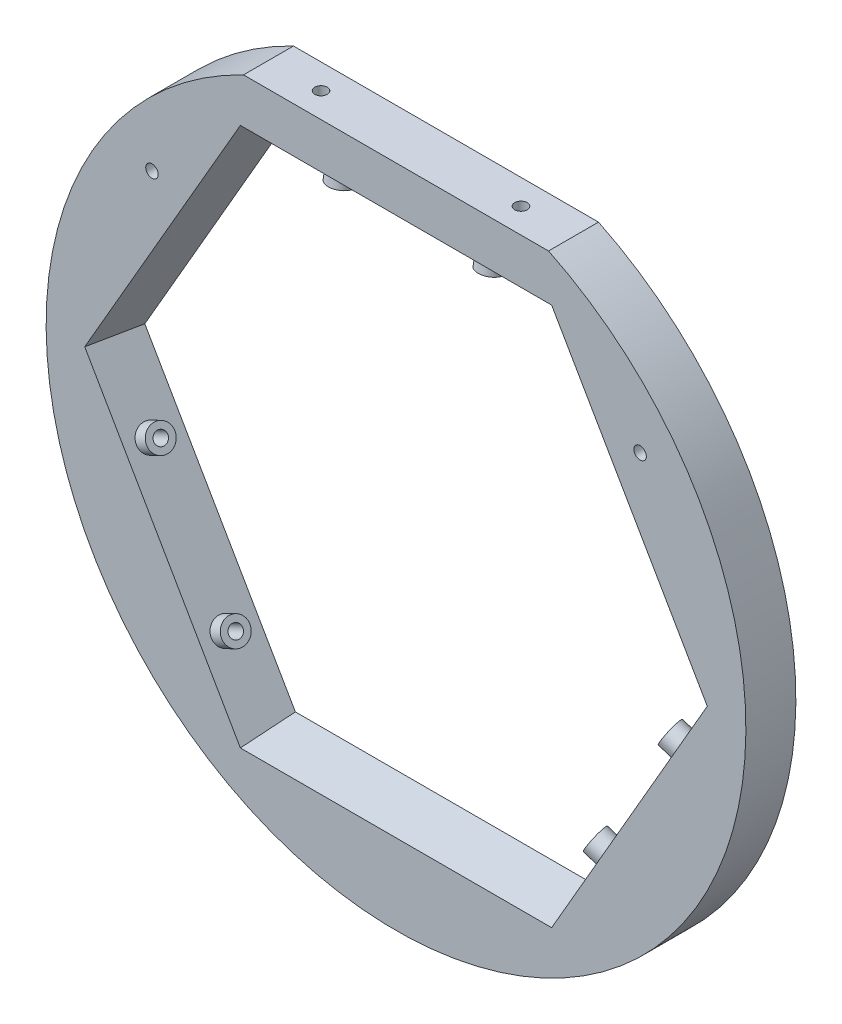
from build123d import *

# Parameters (mm, degrees)
ESQUISSE1_R                  = 70
BOSS_EXTRU_1_DEPTH           = 10
CHANFREIN1_SIZE              = 10.000000024
CHANFREIN1_SIZE_2            = 1.74707794
ESQUISSE2_R                  = 1.25
ENL_V_MAT_EXTRU_1_DEPTH      = 8
BOSS_EXTRU_2_START           = 3
ESQUISSE3_R                  = 2.5
ESQUISSE3_R_2                = 1.25
BOSS_EXTRU_2_DEPTH           = 3
R_P_TITION_CIRCULAIRE1_COUNT = 3
ENL_V_MAT_EXTRU_2_REACH      = 101.499
ESQUISSE5_R                  = 1.25
ENL_V_MAT_EXTRU_3_DEPTH      = 8
ENL_V_MAT_EXTRU_4_REACH      = 101.499
ESQUISSE6_R                  = 1.25


with BuildPart() as part:
    # Esquisse1 → Boss.-Extru.1 (new body)
    with BuildSketch(Plane.XY):
        Circle(ESQUISSE1_R)
        Polygon((60.258047595, 0), (30.129023798, 52.185), (-30.129023798, 52.185), (-60.258047595, 0), (-30.129023798, -52.185), (30.129023798, -52.185), align=None, mode=Mode.SUBTRACT)
    extrude(amount=BOSS_EXTRU_1_DEPTH)

    # Chanfrein1
    # the kernel refuses this chamfer: 10.000000024, 1.74707794 mm, written as the material it takes off along each edge
    with BuildSketch(Plane(origin=(-17.136199158, 74.68923241, 10), x_dir=(0.005735622158407684, -0.0033114629971266528, -0.9999780681851351), z_dir=(-0.49999999999999933, -0.866025403784439, 0))) as chanfrein1_piece_1_section:
        Polygon((CHANFREIN1_SIZE * 0.999978068229, -CHANFREIN1_SIZE * 0.00662292599454), (-CHANFREIN1_SIZE_2 * 0.00662292599425, -CHANFREIN1_SIZE_2 * 0.999978068185), (0, 0), align=None)
    chanfrein1_piece_1 = extrude(amount=112.229346155, mode=Mode.PRIVATE)
    chanfrein1_piece_1 = split(chanfrein1_piece_1, bisect_by=Plane(origin=(-67.992097392, 13.395767196, 6.396743043), z_dir=(0.8660254037844387, 0.5000000000000003, 0)), keep=Keep.TOP, mode=Mode.PRIVATE)
    chanfrein1_piece_1 = split(chanfrein1_piece_1, bisect_by=Plane(origin=(-45.597123391, 52.185, 6.396743043), z_dir=(0, -1, 0)), keep=Keep.TOP, mode=Mode.PRIVATE)
    add(chanfrein1_piece_1, mode=Mode.SUBTRACT)
    with BuildSketch(Plane(origin=(-73.250872235, 22.50423241, 10), x_dir=(0.005735622158407019, 0.0033114629971262776, -0.9999780681851351), z_dir=(0.5000000000000003, -0.8660254037844386, 0))) as chanfrein1_piece_2_section:
        Polygon((CHANFREIN1_SIZE * 0.999978068229, -CHANFREIN1_SIZE * 0.00662292599454), (-CHANFREIN1_SIZE_2 * 0.00662292599425, -CHANFREIN1_SIZE_2 * 0.999978068185), (0, 0), align=None)
    chanfrein1_piece_2 = extrude(amount=112.229346155, mode=Mode.PRIVATE)
    chanfrein1_piece_2 = split(chanfrein1_piece_2, bisect_by=Plane(origin=(-45.597123391, -52.185, 6.396743043), z_dir=(0, 1, 0)), keep=Keep.TOP, mode=Mode.PRIVATE)
    chanfrein1_piece_2 = split(chanfrein1_piece_2, bisect_by=Plane(origin=(-67.992097392, -13.395767196, 6.396743043), z_dir=(0.866025403784439, -0.49999999999999933, 0)), keep=Keep.TOP, mode=Mode.PRIVATE)
    add(chanfrein1_piece_2, mode=Mode.SUBTRACT)
    with BuildSketch(Plane(origin=(-56.114673077, -52.185, 10), x_dir=(0, 0.006622925994253088, -0.9999780681851351), z_dir=(1, 0, 0))) as chanfrein1_piece_3_section:
        Polygon((CHANFREIN1_SIZE * 0.999978068229, -CHANFREIN1_SIZE * 0.00662292599454), (-CHANFREIN1_SIZE_2 * 0.00662292599425, -CHANFREIN1_SIZE_2 * 0.999978068185), (0, 0), align=None)
    chanfrein1_piece_3 = extrude(amount=112.229346155, mode=Mode.PRIVATE)
    chanfrein1_piece_3 = split(chanfrein1_piece_3, bisect_by=Plane(origin=(22.394974001, -65.580767196, 6.396743043), z_dir=(-0.8660254037844392, 0.4999999999999993, 0)), keep=Keep.TOP, mode=Mode.PRIVATE)
    chanfrein1_piece_3 = split(chanfrein1_piece_3, bisect_by=Plane(origin=(-22.394974001, -65.580767196, 6.396743043), z_dir=(0.8660254037844387, 0.5000000000000003, 0)), keep=Keep.TOP, mode=Mode.PRIVATE)
    add(chanfrein1_piece_3, mode=Mode.SUBTRACT)
    with BuildSketch(Plane(origin=(17.136199158, -74.68923241, 10), x_dir=(-0.005735622158407349, 0.0033114629971264585, -0.9999780681851351), z_dir=(0.4999999999999993, 0.8660254037844392, 0))) as chanfrein1_piece_4_section:
        Polygon((CHANFREIN1_SIZE * 0.999978068229, -CHANFREIN1_SIZE * 0.00662292599454), (-CHANFREIN1_SIZE_2 * 0.00662292599425, -CHANFREIN1_SIZE_2 * 0.999978068185), (0, 0), align=None)
    chanfrein1_piece_4 = extrude(amount=112.229346155, mode=Mode.PRIVATE)
    chanfrein1_piece_4 = split(chanfrein1_piece_4, bisect_by=Plane(origin=(45.597123391, -52.185, 6.396743043), z_dir=(0, 1, 0)), keep=Keep.TOP, mode=Mode.PRIVATE)
    chanfrein1_piece_4 = split(chanfrein1_piece_4, bisect_by=Plane(origin=(67.992097392, -13.395767196, 6.396743043), z_dir=(-0.8660254037844386, -0.5000000000000001, 0)), keep=Keep.TOP, mode=Mode.PRIVATE)
    add(chanfrein1_piece_4, mode=Mode.SUBTRACT)
    with BuildSketch(Plane(origin=(73.250872235, -22.50423241, 10), x_dir=(-0.005735622158407169, -0.0033114629971263618, -0.9999780681851351), z_dir=(-0.5000000000000001, 0.8660254037844386, 0))) as chanfrein1_piece_5_section:
        Polygon((CHANFREIN1_SIZE * 0.999978068229, -CHANFREIN1_SIZE * 0.00662292599454), (-CHANFREIN1_SIZE_2 * 0.00662292599425, -CHANFREIN1_SIZE_2 * 0.999978068185), (0, 0), align=None)
    chanfrein1_piece_5 = extrude(amount=112.229346155, mode=Mode.PRIVATE)
    chanfrein1_piece_5 = split(chanfrein1_piece_5, bisect_by=Plane(origin=(67.992097392, 13.395767196, 6.396743043), z_dir=(-0.8660254037844392, 0.4999999999999993, 0)), keep=Keep.TOP, mode=Mode.PRIVATE)
    chanfrein1_piece_5 = split(chanfrein1_piece_5, bisect_by=Plane(origin=(45.597123391, 52.185, 6.396743043), z_dir=(0, -1, 0)), keep=Keep.TOP, mode=Mode.PRIVATE)
    add(chanfrein1_piece_5, mode=Mode.SUBTRACT)
    with BuildSketch(Plane(origin=(56.114673077, 52.185, 10), x_dir=(0, -0.006622925994253088, -0.9999780681851351), z_dir=(-1, 0, 0))) as chanfrein1_piece_6_section:
        Polygon((CHANFREIN1_SIZE * 0.999978068229, -CHANFREIN1_SIZE * 0.00662292599454), (-CHANFREIN1_SIZE_2 * 0.00662292599425, -CHANFREIN1_SIZE_2 * 0.999978068185), (0, 0), align=None)
    chanfrein1_piece_6 = extrude(amount=112.229346155, mode=Mode.PRIVATE)
    chanfrein1_piece_6 = split(chanfrein1_piece_6, bisect_by=Plane(origin=(-22.394974001, 65.580767196, 6.396743043), z_dir=(0.866025403784439, -0.49999999999999933, 0)), keep=Keep.TOP, mode=Mode.PRIVATE)
    chanfrein1_piece_6 = split(chanfrein1_piece_6, bisect_by=Plane(origin=(22.394974001, 65.580767196, 6.396743043), z_dir=(-0.8660254037844386, -0.5000000000000001, 0)), keep=Keep.TOP, mode=Mode.PRIVATE)
    add(chanfrein1_piece_6, mode=Mode.SUBTRACT)
    with BuildSketch(Plane(origin=(-17.136199158, 74.68923241, 10), x_dir=(0.005735622158407684, -0.0033114629971266528, -0.9999780681851351), z_dir=(-0.49999999999999933, -0.866025403784439, 0))) as chanfrein1_piece_7a_section:
        Polygon((CHANFREIN1_SIZE * 0.999978068229, -CHANFREIN1_SIZE * 0.00662292599454), (-CHANFREIN1_SIZE_2 * 0.00662292599425, -CHANFREIN1_SIZE_2 * 0.999978068185), (0, 0), align=None)
    chanfrein1_piece_7a = extrude(amount=112.229346155, mode=Mode.PRIVATE)
    chanfrein1_piece_7a = split(chanfrein1_piece_7a, bisect_by=Plane(origin=(-24.113171626, 52.185, 6.425736603), z_dir=(0, 1, 0)), keep=Keep.TOP, mode=Mode.PRIVATE)
    with BuildSketch(Plane(origin=(56.114673077, 52.185, 10), x_dir=(0, -0.006622925994253088, -0.9999780681851351), z_dir=(-1, 0, 0))) as chanfrein1_piece_7b_section:
        Polygon((CHANFREIN1_SIZE * 0.999978068229, -CHANFREIN1_SIZE * 0.00662292599454), (-CHANFREIN1_SIZE_2 * 0.00662292599425, -CHANFREIN1_SIZE_2 * 0.999978068185), (0, 0), align=None)
    chanfrein1_piece_7b = extrude(amount=112.229346155, mode=Mode.PRIVATE)
    chanfrein1_piece_7b = split(chanfrein1_piece_7b, bisect_by=Plane(origin=(-33.136949884, 46.975119194, 6.425736603), z_dir=(-0.866025403784439, 0.49999999999999933, 0)), keep=Keep.TOP, mode=Mode.PRIVATE)
    chanfrein1_piece_7 = chanfrein1_piece_7a & chanfrein1_piece_7b
    add(chanfrein1_piece_7, mode=Mode.SUBTRACT)
    with BuildSketch(Plane(origin=(-73.250872235, 22.50423241, 10), x_dir=(0.005735622158407019, 0.0033114629971262776, -0.9999780681851351), z_dir=(0.5000000000000003, -0.8660254037844386, 0))) as chanfrein1_piece_8a_section:
        Polygon((CHANFREIN1_SIZE * 0.999978068229, -CHANFREIN1_SIZE * 0.00662292599454), (-CHANFREIN1_SIZE_2 * 0.00662292599425, -CHANFREIN1_SIZE_2 * 0.999978068185), (0, 0), align=None)
    chanfrein1_piece_8a = extrude(amount=112.229346155, mode=Mode.PRIVATE)
    chanfrein1_piece_8a = split(chanfrein1_piece_8a, bisect_by=Plane(origin=(-57.250121509, 5.209880806, 6.425736603), z_dir=(-0.866025403784439, 0.49999999999999933, 0)), keep=Keep.TOP, mode=Mode.PRIVATE)
    with BuildSketch(Plane(origin=(-17.136199158, 74.68923241, 10), x_dir=(0.005735622158407684, -0.0033114629971266528, -0.9999780681851351), z_dir=(-0.49999999999999933, -0.866025403784439, 0))) as chanfrein1_piece_8b_section:
        Polygon((CHANFREIN1_SIZE * 0.999978068229, -CHANFREIN1_SIZE * 0.00662292599454), (-CHANFREIN1_SIZE_2 * 0.00662292599425, -CHANFREIN1_SIZE_2 * 0.999978068185), (0, 0), align=None)
    chanfrein1_piece_8b = extrude(amount=112.229346155, mode=Mode.PRIVATE)
    chanfrein1_piece_8b = split(chanfrein1_piece_8b, bisect_by=Plane(origin=(-57.250121509, -5.209880806, 6.425736603), z_dir=(-0.8660254037844387, -0.5000000000000003, 0)), keep=Keep.TOP, mode=Mode.PRIVATE)
    chanfrein1_piece_8 = chanfrein1_piece_8a & chanfrein1_piece_8b
    add(chanfrein1_piece_8, mode=Mode.SUBTRACT)
    with BuildSketch(Plane(origin=(-56.114673077, -52.185, 10), x_dir=(0, 0.006622925994253088, -0.9999780681851351), z_dir=(1, 0, 0))) as chanfrein1_piece_9a_section:
        Polygon((CHANFREIN1_SIZE * 0.999978068229, -CHANFREIN1_SIZE * 0.00662292599454), (-CHANFREIN1_SIZE_2 * 0.00662292599425, -CHANFREIN1_SIZE_2 * 0.999978068185), (0, 0), align=None)
    chanfrein1_piece_9a = extrude(amount=112.229346155, mode=Mode.PRIVATE)
    chanfrein1_piece_9a = split(chanfrein1_piece_9a, bisect_by=Plane(origin=(-33.136949884, -46.975119194, 6.425736603), z_dir=(-0.8660254037844387, -0.5000000000000003, 0)), keep=Keep.TOP, mode=Mode.PRIVATE)
    with BuildSketch(Plane(origin=(-73.250872235, 22.50423241, 10), x_dir=(0.005735622158407019, 0.0033114629971262776, -0.9999780681851351), z_dir=(0.5000000000000003, -0.8660254037844386, 0))) as chanfrein1_piece_9b_section:
        Polygon((CHANFREIN1_SIZE * 0.999978068229, -CHANFREIN1_SIZE * 0.00662292599454), (-CHANFREIN1_SIZE_2 * 0.00662292599425, -CHANFREIN1_SIZE_2 * 0.999978068185), (0, 0), align=None)
    chanfrein1_piece_9b = extrude(amount=112.229346155, mode=Mode.PRIVATE)
    chanfrein1_piece_9b = split(chanfrein1_piece_9b, bisect_by=Plane(origin=(-24.113171626, -52.185, 6.425736603), z_dir=(0, -1, 0)), keep=Keep.TOP, mode=Mode.PRIVATE)
    chanfrein1_piece_9 = chanfrein1_piece_9a & chanfrein1_piece_9b
    add(chanfrein1_piece_9, mode=Mode.SUBTRACT)
    with BuildSketch(Plane(origin=(17.136199158, -74.68923241, 10), x_dir=(-0.005735622158407349, 0.0033114629971264585, -0.9999780681851351), z_dir=(0.4999999999999993, 0.8660254037844392, 0))) as chanfrein1_piece_10a_section:
        Polygon((CHANFREIN1_SIZE * 0.999978068229, -CHANFREIN1_SIZE * 0.00662292599454), (-CHANFREIN1_SIZE_2 * 0.00662292599425, -CHANFREIN1_SIZE_2 * 0.999978068185), (0, 0), align=None)
    chanfrein1_piece_10a = extrude(amount=112.229346155, mode=Mode.PRIVATE)
    chanfrein1_piece_10a = split(chanfrein1_piece_10a, bisect_by=Plane(origin=(24.113171626, -52.185, 6.425736603), z_dir=(0, -1, 0)), keep=Keep.TOP, mode=Mode.PRIVATE)
    with BuildSketch(Plane(origin=(-56.114673077, -52.185, 10), x_dir=(0, 0.006622925994253088, -0.9999780681851351), z_dir=(1, 0, 0))) as chanfrein1_piece_10b_section:
        Polygon((CHANFREIN1_SIZE * 0.999978068229, -CHANFREIN1_SIZE * 0.00662292599454), (-CHANFREIN1_SIZE_2 * 0.00662292599425, -CHANFREIN1_SIZE_2 * 0.999978068185), (0, 0), align=None)
    chanfrein1_piece_10b = extrude(amount=112.229346155, mode=Mode.PRIVATE)
    chanfrein1_piece_10b = split(chanfrein1_piece_10b, bisect_by=Plane(origin=(33.136949884, -46.975119194, 6.425736603), z_dir=(0.8660254037844392, -0.4999999999999993, 0)), keep=Keep.TOP, mode=Mode.PRIVATE)
    chanfrein1_piece_10 = chanfrein1_piece_10a & chanfrein1_piece_10b
    add(chanfrein1_piece_10, mode=Mode.SUBTRACT)
    with BuildSketch(Plane(origin=(17.136199158, -74.68923241, 10), x_dir=(-0.005735622158407349, 0.0033114629971264585, -0.9999780681851351), z_dir=(0.4999999999999993, 0.8660254037844392, 0))) as chanfrein1_piece_11a_section:
        Polygon((CHANFREIN1_SIZE * 0.999978068229, -CHANFREIN1_SIZE * 0.00662292599454), (-CHANFREIN1_SIZE_2 * 0.00662292599425, -CHANFREIN1_SIZE_2 * 0.999978068185), (0, 0), align=None)
    chanfrein1_piece_11a = extrude(amount=112.229346155, mode=Mode.PRIVATE)
    chanfrein1_piece_11a = split(chanfrein1_piece_11a, bisect_by=Plane(origin=(57.250121509, 5.209880806, 6.425736603), z_dir=(0.8660254037844386, 0.5000000000000001, 0)), keep=Keep.TOP, mode=Mode.PRIVATE)
    with BuildSketch(Plane(origin=(73.250872235, -22.50423241, 10), x_dir=(-0.005735622158407169, -0.0033114629971263618, -0.9999780681851351), z_dir=(-0.5000000000000001, 0.8660254037844386, 0))) as chanfrein1_piece_11b_section:
        Polygon((CHANFREIN1_SIZE * 0.999978068229, -CHANFREIN1_SIZE * 0.00662292599454), (-CHANFREIN1_SIZE_2 * 0.00662292599425, -CHANFREIN1_SIZE_2 * 0.999978068185), (0, 0), align=None)
    chanfrein1_piece_11b = extrude(amount=112.229346155, mode=Mode.PRIVATE)
    chanfrein1_piece_11b = split(chanfrein1_piece_11b, bisect_by=Plane(origin=(57.250121509, -5.209880806, 6.425736603), z_dir=(0.8660254037844392, -0.4999999999999993, 0)), keep=Keep.TOP, mode=Mode.PRIVATE)
    chanfrein1_piece_11 = chanfrein1_piece_11a & chanfrein1_piece_11b
    add(chanfrein1_piece_11, mode=Mode.SUBTRACT)
    with BuildSketch(Plane(origin=(56.114673077, 52.185, 10), x_dir=(0, -0.006622925994253088, -0.9999780681851351), z_dir=(-1, 0, 0))) as chanfrein1_piece_12a_section:
        Polygon((CHANFREIN1_SIZE * 0.999978068229, -CHANFREIN1_SIZE * 0.00662292599454), (-CHANFREIN1_SIZE_2 * 0.00662292599425, -CHANFREIN1_SIZE_2 * 0.999978068185), (0, 0), align=None)
    chanfrein1_piece_12a = extrude(amount=112.229346155, mode=Mode.PRIVATE)
    chanfrein1_piece_12a = split(chanfrein1_piece_12a, bisect_by=Plane(origin=(33.136949884, 46.975119194, 6.425736603), z_dir=(0.8660254037844386, 0.5000000000000001, 0)), keep=Keep.TOP, mode=Mode.PRIVATE)
    with BuildSketch(Plane(origin=(73.250872235, -22.50423241, 10), x_dir=(-0.005735622158407169, -0.0033114629971263618, -0.9999780681851351), z_dir=(-0.5000000000000001, 0.8660254037844386, 0))) as chanfrein1_piece_12b_section:
        Polygon((CHANFREIN1_SIZE * 0.999978068229, -CHANFREIN1_SIZE * 0.00662292599454), (-CHANFREIN1_SIZE_2 * 0.00662292599425, -CHANFREIN1_SIZE_2 * 0.999978068185), (0, 0), align=None)
    chanfrein1_piece_12b = extrude(amount=112.229346155, mode=Mode.PRIVATE)
    chanfrein1_piece_12b = split(chanfrein1_piece_12b, bisect_by=Plane(origin=(24.113171626, 52.185, 6.425736603), z_dir=(0, 1, 0)), keep=Keep.TOP, mode=Mode.PRIVATE)
    chanfrein1_piece_12 = chanfrein1_piece_12a & chanfrein1_piece_12b
    add(chanfrein1_piece_12, mode=Mode.SUBTRACT)

    # Esquisse2 → Enlèv. mat.-Extru.1 (cut)
    with BuildSketch(Plane(origin=(-43.854958982, -25.319672374, -8.847088189), x_dir=(0.1490438654456729, 0.0860505158361217, -0.9850793038620543), z_dir=(0.8531037018868293, 0.4925396519310274, 0.17210103167224328))):
        with Locations(Location((-14.636825815, 15, 0), (0, 0, 90))):
            Circle(ESQUISSE2_R)
        with Locations(Location((-14.636825815, -15, 0), (0, 0, 90))):
            Circle(ESQUISSE2_R)
    enl_v_mat_extru_1 = extrude(amount=-ENL_V_MAT_EXTRU_1_DEPTH, mode=Mode.SUBTRACT)

    # Esquisse3 → Boss.-Extru.2 (add)
    # profile 1 of 2: a face of its own
    with BuildSketch(Plane(origin=(-43.854958982, -25.319672374, -8.847088189), x_dir=(0.1490438654456729, 0.0860505158361217, -0.9850793038620543), z_dir=(0.8531037018868293, 0.4925396519310274, 0.17210103167224328)).offset(BOSS_EXTRU_2_START)):
        with Locations(Location((-14.636825815, -15, 0), (0, 0, 90))):
            Circle(ESQUISSE3_R)
        with Locations(Location((-14.636825815, -15, 0), (0, 0, 90))):
            Circle(ESQUISSE3_R_2, mode=Mode.SUBTRACT)
    # profile 2 of 2: a face of its own
    with BuildSketch(Plane(origin=(-43.854958982, -25.319672374, -8.847088189), x_dir=(0.1490438654456729, 0.0860505158361217, -0.9850793038620543), z_dir=(0.8531037018868293, 0.4925396519310274, 0.17210103167224328)).offset(BOSS_EXTRU_2_START)):
        with Locations(Location((-14.636825815, 15, 0), (0, 0, 90))):
            Circle(ESQUISSE3_R)
        with Locations(Location((-14.636825815, 15, 0), (0, 0, 90))):
            Circle(ESQUISSE3_R_2, mode=Mode.SUBTRACT)
    boss_extru_2 = extrude(amount=-BOSS_EXTRU_2_DEPTH)

    # Répétition circulaire1: Enlèv. mat.-Extru.1, Boss.-Extru.2 ×3 about axis
    r_p_tition_circulaire1_axis = Axis((0, 0, 0), (0, 0, 1))
    add([enl_v_mat_extru_1.rotate(r_p_tition_circulaire1_axis, i * 360 / R_P_TITION_CIRCULAIRE1_COUNT) for i in range(1, R_P_TITION_CIRCULAIRE1_COUNT)], mode=Mode.SUBTRACT)
    add([boss_extru_2.rotate(r_p_tition_circulaire1_axis, i * 360 / R_P_TITION_CIRCULAIRE1_COUNT) for i in range(1, R_P_TITION_CIRCULAIRE1_COUNT)])

    # Esquisse4 → Enlèv. mat.-Extru.2 (cut, up to next)
    with BuildSketch(Plane(origin=(0, 0, 0), x_dir=(-1, 0, 0), z_dir=(0, 0, -1)), mode=Mode.PRIVATE) as enl_v_mat_extru_2_sk1:
        with BuildLine():
            Line((30.512292605, 63), (-30.512292605, 63))
            ThreePointArc((-30.512292605, 63), (0, 70), (30.512292605, 63))
        make_face()
    enl_v_mat_extru_2_tool1 = extrude(enl_v_mat_extru_2_sk1.sketch, amount=-ENL_V_MAT_EXTRU_2_REACH, mode=Mode.PRIVATE) & part.part
    add(enl_v_mat_extru_2_tool1.solids().sort_by_distance((0, 65.812358, 0))[0], mode=Mode.SUBTRACT)

    # Esquisse5 → Enlèv. mat.-Extru.3 (cut)
    with BuildSketch(Plane(origin=(0, 63, 0), x_dir=(1, 0, 0), z_dir=(0, 1, 0))):
        with Locations(Location((-20, -5, 0), (0, 0, 270))):
            Circle(ESQUISSE5_R)
        with Locations(Location((20, -5, 0), (0, 0, 270))):
            Circle(ESQUISSE5_R)
    extrude(amount=-ENL_V_MAT_EXTRU_3_DEPTH, mode=Mode.SUBTRACT)

    # Esquisse6 → Enlèv. mat.-Extru.4 (cut, up to next)
    with BuildSketch(Plane(origin=(0, 0, 0), x_dir=(-1, 0, 0), z_dir=(0, 0, -1)), mode=Mode.PRIVATE) as enl_v_mat_extru_4_sk1:
        with Locations((48.823650244, 37.185)):
            Circle(ESQUISSE6_R)
    enl_v_mat_extru_4_tool1 = extrude(enl_v_mat_extru_4_sk1.sketch, amount=-ENL_V_MAT_EXTRU_4_REACH, mode=Mode.PRIVATE) & part.part
    # Esquisse6 → Enlèv. mat.-Extru.4 (cut, up to next)
    with BuildSketch(Plane(origin=(0, 0, 0), x_dir=(-1, 0, 0), z_dir=(0, 0, -1)), mode=Mode.PRIVATE) as enl_v_mat_extru_4_sk2:
        with Locations((-48.823650244, 37.185)):
            Circle(ESQUISSE6_R)
    enl_v_mat_extru_4_tool2 = extrude(enl_v_mat_extru_4_sk2.sketch, amount=-ENL_V_MAT_EXTRU_4_REACH, mode=Mode.PRIVATE) & part.part
    add(enl_v_mat_extru_4_tool1.solids().sort_by_distance((-48.82365, 37.185, 0))[0], mode=Mode.SUBTRACT)
    add(enl_v_mat_extru_4_tool2.solids().sort_by_distance((48.82365, 37.185, 0))[0], mode=Mode.SUBTRACT)


solid = part.part
